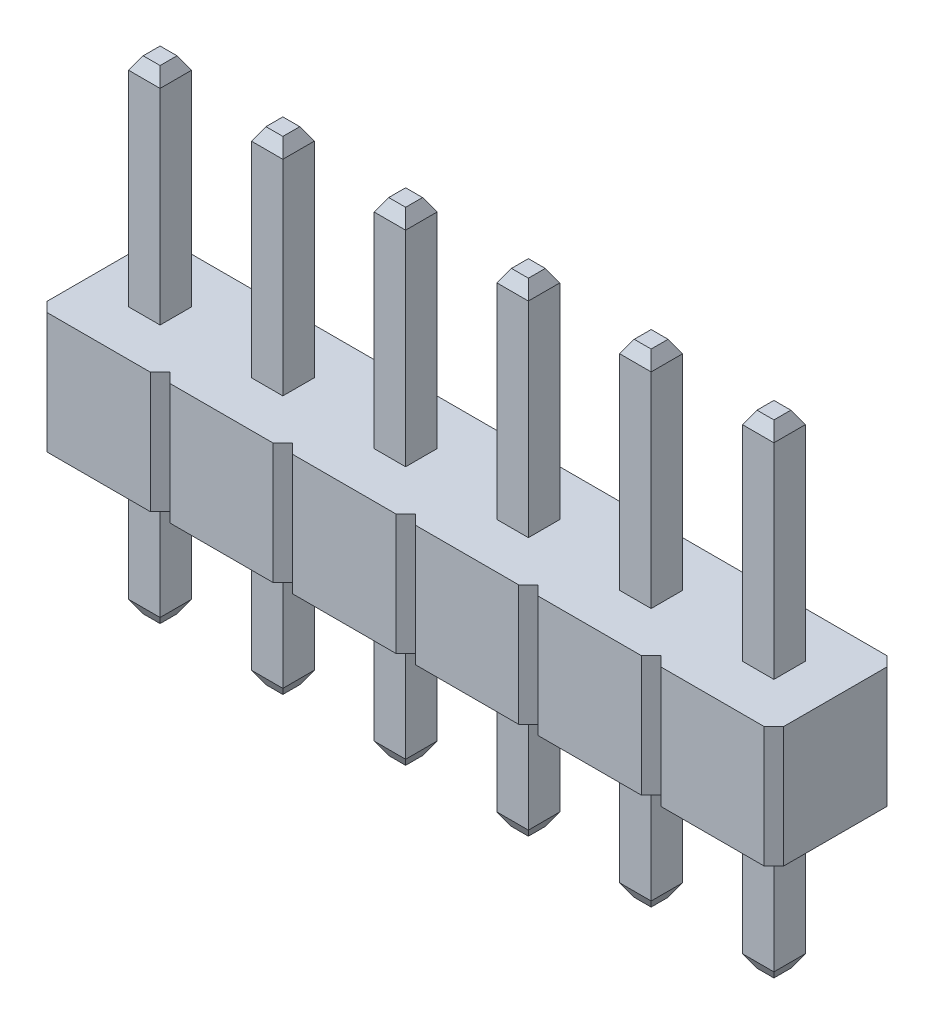
from build123d import *

# Parameters (mm, degrees)
BOSS_EXTRUDE1_DEPTH   = 2.5
SKETCH3_W             = 0.65
SKETCH3_H             = 0.65
BOSS_EXTRUDE2_DEPTH   = 10
CHAMFER2_SIZE         = 0.15
CHAMFER2_SIZE2        = 0.259807621
CHAMFER3_SIZE         = 0.15
CHAMFER3_SIZE2        = 0.259807621
LPATTERN2_DEPTH       = 2.5
LPATTERN2_START       = -2.740192379
LPATTERN2_2_OUTLINE_W = 0.65
LPATTERN2_2_OUTLINE_H = 0.65
LPATTERN2_2_DEPTH     = 9.480384758


with BuildPart() as part:
    # Sketch1 → Boss-Extrude1 (new body)
    with BuildSketch(Plane(origin=(0, 0, 0), x_dir=(1, 0, 0), z_dir=(0, 1, 0))):
        Polygon((-7.42, 1.27), (-7.62, 1.07), (-7.62, -1.07), (-7.42, -1.27), (-5.28, -1.27), (-5.08, -1.07), (-5.08, 1.07), (-5.28, 1.27), align=None)
    extrude(amount=BOSS_EXTRUDE1_DEPTH)

    # Sketch3 → Boss-Extrude2 (add)
    with BuildSketch(Plane(origin=(0, -3, 0), x_dir=(1, 0, 0), z_dir=(0, 1, 0))):
        with Locations((-6.35, 0)):
            Rectangle(SKETCH3_W, SKETCH3_H)
    extrude(amount=BOSS_EXTRUDE2_DEPTH)

    # Chamfer2
    chamfer2_edges = [part.edges().sort_by_distance(p)[0] for p in [
        (-6.025, -3, 0),
        (-6.35, -3, -0.325),
        (-6.675, -3, 0),
        (-6.35, -3, 0.325),
    ]]
    chamfer2_side = [part.faces().sort_by_distance(p)[0] for p in [
        (-6.35, -3, 0),
    ]]
    chamfer(chamfer2_edges, length=CHAMFER2_SIZE, length2=CHAMFER2_SIZE2, reference=chamfer2_side[0])

    # Chamfer3
    chamfer3_edges = [part.edges().sort_by_distance(p)[0] for p in [
        (-6.025, 7, 0),
        (-6.35, 7, -0.325),
        (-6.675, 7, 0),
        (-6.35, 7, 0.325),
    ]]
    chamfer3_side = [part.faces().sort_by_distance(p)[0] for p in [
        (-6.35, 7, 0),
    ]]
    chamfer(chamfer3_edges, length=CHAMFER3_SIZE, length2=CHAMFER3_SIZE2, reference=chamfer3_side[0])

    # LPattern2: read off the stored shape, not the designer's step
    # LPattern2 outline → LPattern2 (add)
    with BuildSketch(Plane(origin=(0, 0, 0), x_dir=(1, 0, 0), z_dir=(0, 1, 0))):
        Polygon((-2.74, 1.27), (-4.88, 1.27), (-5.08, 1.07), (-5.08, -1.07), (-4.88, -1.27), (-2.74, -1.27), (-2.54, -1.07), (-2.34, -1.27), (-0.2, -1.27), (0, -1.07), (0.2, -1.27), (2.34, -1.27), (2.54, -1.07), (2.74, -1.27), (4.88, -1.27), (5.08, -1.07), (5.28, -1.27), (7.42, -1.27), (7.62, -1.07), (7.62, 1.07), (7.42, 1.27), (5.28, 1.27), (5.08, 1.07), (4.88, 1.27), (2.74, 1.27), (2.54, 1.07), (2.34, 1.27), (0.2, 1.27), (0, 1.07), (-0.2, 1.27), (-2.34, 1.27), (-2.54, 1.07), align=None)
    extrude(amount=LPATTERN2_DEPTH)

    # LPattern2 2 outline → LPattern2 2 (add)
    with BuildSketch(Plane(origin=(0, 0, 0), x_dir=(1, 0, 0), z_dir=(0, 1, 0)).offset(LPATTERN2_START)):
        with Locations((-3.81, 0)):
            Rectangle(LPATTERN2_2_OUTLINE_W, LPATTERN2_2_OUTLINE_H)
        with Locations((-1.27, 0)):
            Rectangle(LPATTERN2_2_OUTLINE_W, LPATTERN2_2_OUTLINE_H)
        with Locations((1.27, 0)):
            Rectangle(LPATTERN2_2_OUTLINE_W, LPATTERN2_2_OUTLINE_H)
        with Locations((3.81, 0)):
            Rectangle(LPATTERN2_2_OUTLINE_W, LPATTERN2_2_OUTLINE_H)
        with Locations((6.35, 0)):
            Rectangle(LPATTERN2_2_OUTLINE_W, LPATTERN2_2_OUTLINE_H)
    extrude(amount=LPATTERN2_2_DEPTH)

    # LPattern2 3: loft between two sections, ruled curve by curve
    lpattern2_3_from = [
        Edge.make_line((-3.985, -3, 0.175), (-3.635, -3, 0.175)),
        Edge.make_line((-3.635, -3, -0.175), (-3.985, -3, -0.175)),
        Edge.make_line((-3.635, -3, 0.175), (-3.635, -3, -0.175)),
        Edge.make_line((-3.985, -3, 0.175), (-3.985, -3, -0.175)),
    ]
    lpattern2_3_to = [
        Edge.make_line((-4.135, -2.740192379, 0.325), (-3.485, -2.740192379, 0.325)),
        Edge.make_line((-3.485, -2.740192379, -0.325), (-4.135, -2.740192379, -0.325)),
        Edge.make_line((-3.485, -2.740192379, 0.325), (-3.485, -2.740192379, -0.325)),
        Edge.make_line((-4.135, -2.740192379, 0.325), (-4.135, -2.740192379, -0.325)),
    ]
    lpattern2_3 = Solid(Shell([*[Face.make_surface_from_curves(lpattern2_3_from[k], lpattern2_3_to[k]) for k in range(4)], Face(Wire(lpattern2_3_from)), Face(Wire(lpattern2_3_to))]))
    add(lpattern2_3)

    # LPattern2 4: loft between two sections, ruled curve by curve
    lpattern2_4_from = [
        Edge.make_line((-1.445, -3, 0.175), (-1.095, -3, 0.175)),
        Edge.make_line((-1.095, -3, -0.175), (-1.445, -3, -0.175)),
        Edge.make_line((-1.095, -3, 0.175), (-1.095, -3, -0.175)),
        Edge.make_line((-1.445, -3, 0.175), (-1.445, -3, -0.175)),
    ]
    lpattern2_4_to = [
        Edge.make_line((-1.595, -2.740192379, 0.325), (-0.945, -2.740192379, 0.325)),
        Edge.make_line((-0.945, -2.740192379, -0.325), (-1.595, -2.740192379, -0.325)),
        Edge.make_line((-0.945, -2.740192379, 0.325), (-0.945, -2.740192379, -0.325)),
        Edge.make_line((-1.595, -2.740192379, 0.325), (-1.595, -2.740192379, -0.325)),
    ]
    lpattern2_4 = Solid(Shell([*[Face.make_surface_from_curves(lpattern2_4_from[k], lpattern2_4_to[k]) for k in range(4)], Face(Wire(lpattern2_4_from)), Face(Wire(lpattern2_4_to))]))
    add(lpattern2_4)

    # LPattern2 5: loft between two sections, ruled curve by curve
    lpattern2_5_from = [
        Edge.make_line((1.095, -3, 0.175), (1.445, -3, 0.175)),
        Edge.make_line((1.445, -3, -0.175), (1.095, -3, -0.175)),
        Edge.make_line((1.445, -3, 0.175), (1.445, -3, -0.175)),
        Edge.make_line((1.095, -3, 0.175), (1.095, -3, -0.175)),
    ]
    lpattern2_5_to = [
        Edge.make_line((0.945, -2.740192379, 0.325), (1.595, -2.740192379, 0.325)),
        Edge.make_line((1.595, -2.740192379, -0.325), (0.945, -2.740192379, -0.325)),
        Edge.make_line((1.595, -2.740192379, 0.325), (1.595, -2.740192379, -0.325)),
        Edge.make_line((0.945, -2.740192379, 0.325), (0.945, -2.740192379, -0.325)),
    ]
    lpattern2_5 = Solid(Shell([*[Face.make_surface_from_curves(lpattern2_5_from[k], lpattern2_5_to[k]) for k in range(4)], Face(Wire(lpattern2_5_from)), Face(Wire(lpattern2_5_to))]))
    add(lpattern2_5)

    # LPattern2 6: loft between two sections, ruled curve by curve
    lpattern2_6_from = [
        Edge.make_line((3.635, -3, 0.175), (3.985, -3, 0.175)),
        Edge.make_line((3.985, -3, -0.175), (3.635, -3, -0.175)),
        Edge.make_line((3.985, -3, 0.175), (3.985, -3, -0.175)),
        Edge.make_line((3.635, -3, 0.175), (3.635, -3, -0.175)),
    ]
    lpattern2_6_to = [
        Edge.make_line((3.485, -2.740192379, 0.325), (4.135, -2.740192379, 0.325)),
        Edge.make_line((4.135, -2.740192379, -0.325), (3.485, -2.740192379, -0.325)),
        Edge.make_line((4.135, -2.740192379, 0.325), (4.135, -2.740192379, -0.325)),
        Edge.make_line((3.485, -2.740192379, 0.325), (3.485, -2.740192379, -0.325)),
    ]
    lpattern2_6 = Solid(Shell([*[Face.make_surface_from_curves(lpattern2_6_from[k], lpattern2_6_to[k]) for k in range(4)], Face(Wire(lpattern2_6_from)), Face(Wire(lpattern2_6_to))]))
    add(lpattern2_6)

    # LPattern2 7: loft between two sections, ruled curve by curve
    lpattern2_7_from = [
        Edge.make_line((6.175, -3, 0.175), (6.525, -3, 0.175)),
        Edge.make_line((6.525, -3, -0.175), (6.175, -3, -0.175)),
        Edge.make_line((6.525, -3, 0.175), (6.525, -3, -0.175)),
        Edge.make_line((6.175, -3, 0.175), (6.175, -3, -0.175)),
    ]
    lpattern2_7_to = [
        Edge.make_line((6.025, -2.740192379, 0.325), (6.675, -2.740192379, 0.325)),
        Edge.make_line((6.675, -2.740192379, -0.325), (6.025, -2.740192379, -0.325)),
        Edge.make_line((6.675, -2.740192379, 0.325), (6.675, -2.740192379, -0.325)),
        Edge.make_line((6.025, -2.740192379, 0.325), (6.025, -2.740192379, -0.325)),
    ]
    lpattern2_7 = Solid(Shell([*[Face.make_surface_from_curves(lpattern2_7_from[k], lpattern2_7_to[k]) for k in range(4)], Face(Wire(lpattern2_7_from)), Face(Wire(lpattern2_7_to))]))
    add(lpattern2_7)

    # LPattern2 8: loft between two sections, ruled curve by curve
    lpattern2_8_from = [
        Edge.make_line((-3.485, 6.740192379, -0.325), (-4.135, 6.740192379, -0.325)),
        Edge.make_line((-4.135, 6.740192379, 0.325), (-3.485, 6.740192379, 0.325)),
        Edge.make_line((-4.135, 6.740192379, -0.325), (-4.135, 6.740192379, 0.325)),
        Edge.make_line((-3.485, 6.740192379, -0.325), (-3.485, 6.740192379, 0.325)),
    ]
    lpattern2_8_to = [
        Edge.make_line((-3.635, 7, -0.175), (-3.985, 7, -0.175)),
        Edge.make_line((-3.985, 7, 0.175), (-3.635, 7, 0.175)),
        Edge.make_line((-3.985, 7, -0.175), (-3.985, 7, 0.175)),
        Edge.make_line((-3.635, 7, -0.175), (-3.635, 7, 0.175)),
    ]
    lpattern2_8 = Solid(Shell([*[Face.make_surface_from_curves(lpattern2_8_from[k], lpattern2_8_to[k]) for k in range(4)], Face(Wire(lpattern2_8_from)), Face(Wire(lpattern2_8_to))]))
    add(lpattern2_8)

    # LPattern2 9: loft between two sections, ruled curve by curve
    lpattern2_9_from = [
        Edge.make_line((-0.945, 6.740192379, -0.325), (-1.595, 6.740192379, -0.325)),
        Edge.make_line((-1.595, 6.740192379, 0.325), (-0.945, 6.740192379, 0.325)),
        Edge.make_line((-1.595, 6.740192379, -0.325), (-1.595, 6.740192379, 0.325)),
        Edge.make_line((-0.945, 6.740192379, -0.325), (-0.945, 6.740192379, 0.325)),
    ]
    lpattern2_9_to = [
        Edge.make_line((-1.095, 7, -0.175), (-1.445, 7, -0.175)),
        Edge.make_line((-1.445, 7, 0.175), (-1.095, 7, 0.175)),
        Edge.make_line((-1.445, 7, -0.175), (-1.445, 7, 0.175)),
        Edge.make_line((-1.095, 7, -0.175), (-1.095, 7, 0.175)),
    ]
    lpattern2_9 = Solid(Shell([*[Face.make_surface_from_curves(lpattern2_9_from[k], lpattern2_9_to[k]) for k in range(4)], Face(Wire(lpattern2_9_from)), Face(Wire(lpattern2_9_to))]))
    add(lpattern2_9)

    # LPattern2 10: loft between two sections, ruled curve by curve
    lpattern2_10_from = [
        Edge.make_line((1.595, 6.740192379, -0.325), (0.945, 6.740192379, -0.325)),
        Edge.make_line((0.945, 6.740192379, 0.325), (1.595, 6.740192379, 0.325)),
        Edge.make_line((0.945, 6.740192379, -0.325), (0.945, 6.740192379, 0.325)),
        Edge.make_line((1.595, 6.740192379, -0.325), (1.595, 6.740192379, 0.325)),
    ]
    lpattern2_10_to = [
        Edge.make_line((1.445, 7, -0.175), (1.095, 7, -0.175)),
        Edge.make_line((1.095, 7, 0.175), (1.445, 7, 0.175)),
        Edge.make_line((1.095, 7, -0.175), (1.095, 7, 0.175)),
        Edge.make_line((1.445, 7, -0.175), (1.445, 7, 0.175)),
    ]
    lpattern2_10 = Solid(Shell([*[Face.make_surface_from_curves(lpattern2_10_from[k], lpattern2_10_to[k]) for k in range(4)], Face(Wire(lpattern2_10_from)), Face(Wire(lpattern2_10_to))]))
    add(lpattern2_10)

    # LPattern2 11: loft between two sections, ruled curve by curve
    lpattern2_11_from = [
        Edge.make_line((4.135, 6.740192379, -0.325), (3.485, 6.740192379, -0.325)),
        Edge.make_line((3.485, 6.740192379, 0.325), (4.135, 6.740192379, 0.325)),
        Edge.make_line((3.485, 6.740192379, -0.325), (3.485, 6.740192379, 0.325)),
        Edge.make_line((4.135, 6.740192379, -0.325), (4.135, 6.740192379, 0.325)),
    ]
    lpattern2_11_to = [
        Edge.make_line((3.985, 7, -0.175), (3.635, 7, -0.175)),
        Edge.make_line((3.635, 7, 0.175), (3.985, 7, 0.175)),
        Edge.make_line((3.635, 7, -0.175), (3.635, 7, 0.175)),
        Edge.make_line((3.985, 7, -0.175), (3.985, 7, 0.175)),
    ]
    lpattern2_11 = Solid(Shell([*[Face.make_surface_from_curves(lpattern2_11_from[k], lpattern2_11_to[k]) for k in range(4)], Face(Wire(lpattern2_11_from)), Face(Wire(lpattern2_11_to))]))
    add(lpattern2_11)

    # LPattern2 12: loft between two sections, ruled curve by curve
    lpattern2_12_from = [
        Edge.make_line((6.675, 6.740192379, -0.325), (6.025, 6.740192379, -0.325)),
        Edge.make_line((6.025, 6.740192379, 0.325), (6.675, 6.740192379, 0.325)),
        Edge.make_line((6.025, 6.740192379, -0.325), (6.025, 6.740192379, 0.325)),
        Edge.make_line((6.675, 6.740192379, -0.325), (6.675, 6.740192379, 0.325)),
    ]
    lpattern2_12_to = [
        Edge.make_line((6.525, 7, -0.175), (6.175, 7, -0.175)),
        Edge.make_line((6.175, 7, 0.175), (6.525, 7, 0.175)),
        Edge.make_line((6.175, 7, -0.175), (6.175, 7, 0.175)),
        Edge.make_line((6.525, 7, -0.175), (6.525, 7, 0.175)),
    ]
    lpattern2_12 = Solid(Shell([*[Face.make_surface_from_curves(lpattern2_12_from[k], lpattern2_12_to[k]) for k in range(4)], Face(Wire(lpattern2_12_from)), Face(Wire(lpattern2_12_to))]))
    add(lpattern2_12)


solid = part.part
